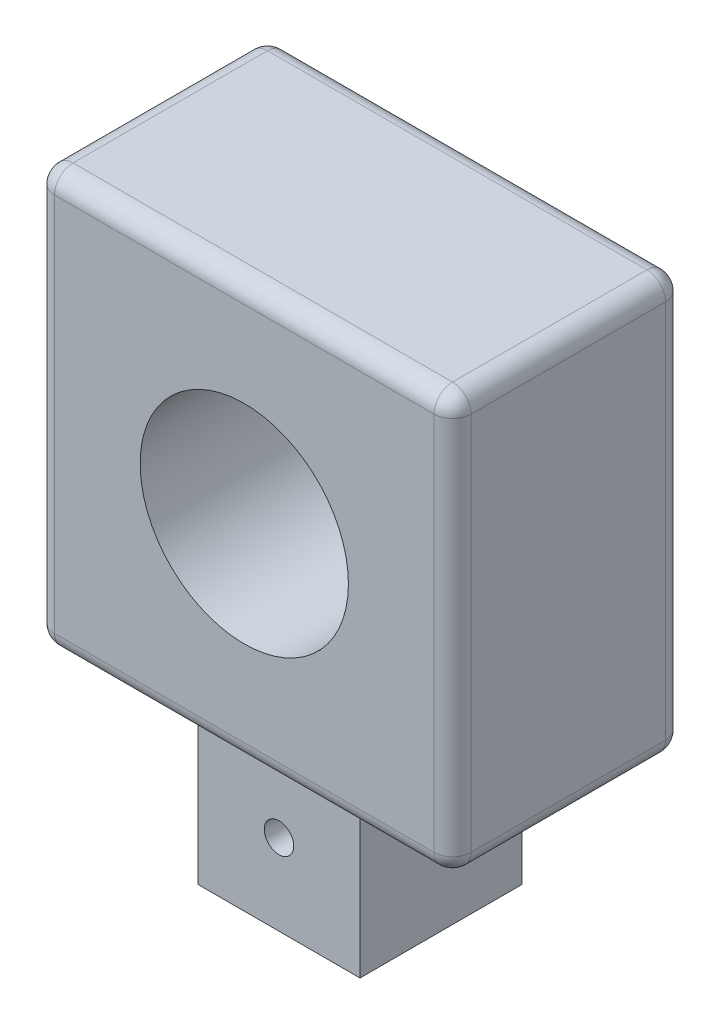
from build123d import *

# Parameters (mm, degrees)
BOSS_EXTRUDE1_DEPTH      = 12.7
BOSS_EXTRUDE1_DEPTH_BACK = 9.525
SKETCH1_W                = 22.225
SKETCH1_H                = 22.225
SKETCH2_W                = 57.15
SKETCH2_H                = 31.75
BOSS_EXTRUDE2_DEPTH      = 57.15
SKETCH3_R                = 14.2875
CUT_EXTRUDE1_DEPTH       = 82.875610685
FILLET1_R                = 2.54
SKETCH4_R                = 2.0193
CUT_EXTRUDE2_DEPTH       = 81.149100315


with BuildPart() as part:
    # Sketch1 → Boss-Extrude1 (new, two sides: drawn at the far end of the back side and taken through both)
    with BuildSketch(Plane(origin=(0, 0, 0), x_dir=(1, 0, 0), z_dir=(0, 1, 0)).offset(-BOSS_EXTRUDE1_DEPTH_BACK)):
        Rectangle(SKETCH1_W, SKETCH1_H)
    extrude(amount=BOSS_EXTRUDE1_DEPTH + BOSS_EXTRUDE1_DEPTH_BACK)

    # Sketch2 → Boss-Extrude2 (add)
    with BuildSketch(Plane(origin=(0, 12.7, 0), x_dir=(1, 0, 0), z_dir=(0, 1, 0))):
        Rectangle(SKETCH2_W, SKETCH2_H)
    extrude(amount=BOSS_EXTRUDE2_DEPTH)

    # Sketch3 → Cut-Extrude1 (cut, through all)
    with BuildSketch(Plane.XY.offset(15.875)):
        with Locations((0, 41.275)):
            Circle(SKETCH3_R)
    extrude(amount=-CUT_EXTRUDE1_DEPTH, mode=Mode.SUBTRACT)

    # Fillet1
    fillet1_edges = [part.edges().sort_by_distance(p)[0] for p in [
        (28.575, 69.85, 0),
        (28.575, 12.7, 0),
        (-28.575, 69.85, 0),
        (-28.575, 12.7, 0),
        (28.575, 41.275, -15.875),
        (0, 69.85, -15.875),
        (-28.575, 41.275, -15.875),
        (0, 12.7, -15.875),
        (-28.575, 41.275, 15.875),
        (0, 69.85, 15.875),
        (28.575, 41.275, 15.875),
        (0, 12.7, 15.875),
    ]]
    fillet(fillet1_edges, radius=FILLET1_R)

    # Sketch4 → Cut-Extrude2 (cut, through all)
    with BuildSketch(Plane(origin=(0, 0, -11.1125), x_dir=(-1, 0, 0), z_dir=(0, 0, -1))):
        with Locations((0, 1.5875)):
            Circle(SKETCH4_R)
    extrude(amount=-CUT_EXTRUDE2_DEPTH, mode=Mode.SUBTRACT)


solid = part.part
